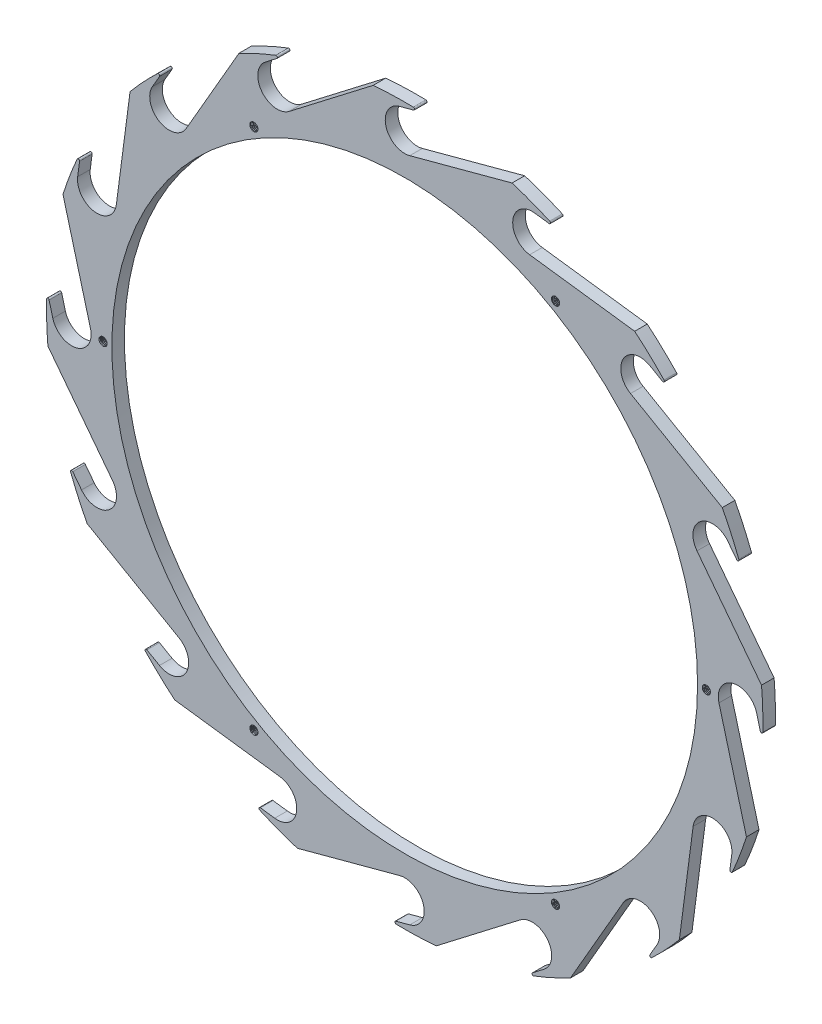
from build123d import *

# Parameters (mm, degrees)
SCHIZZO1_R                   = 233
ESTRUSIONE_ESTRUSIONE1_DEPTH = 10
RACCORDO2_R                  = 1
SCHIZZO2_R                   = 3.25
TAGLIO_ESTRUSIONE1_DEPTH     = 10
FILETTATURA1_PITCH           = 1
RIPETIZIONECIRCOLARE1_COUNT  = 6


with BuildPart() as part:
    # Schizzo1 → Estrusione-Estrusione1 (new body)
    with BuildSketch(Plane.XY):
        with BuildLine():
            Line((4.021991586, -279.969087604), (-13.509722748, -284.679622367))
            ThreePointArc((-13.509722748, -284.679622367), (5.828317807, -284.940398525), (25.139519914, -283.889070833))
            Line((25.139519914, -283.889070833), (91.966852047, -232.537592003))
            ThreePointArc((91.966852047, -232.537592003), (113.701593689, -235.383818586), (110.855367107, -257.118560228))
            Line((110.855367107, -257.118560228), (96.460818675, -268.1796235))
            ThreePointArc((96.460818675, -268.1796235), (114.426633258, -261.020201519), (131.865531943, -252.658824278))
            Line((131.865531943, -252.658824278), (173.954576137, -179.642531186))
            ThreePointArc((173.954576137, -179.642531186), (195.124062843, -173.954576137), (200.812017891, -195.124062843))
            Line((200.812017891, -195.124062843), (191.746074875, -210.851708009))
            ThreePointArc((191.746074875, -210.851708009), (205.604531075, -197.362044987), (218.516212097, -182.963562084))
            Line((218.516212097, -182.963562084), (229.459292913, -99.39852346))
            ThreePointArc((229.459292913, -99.39852346), (246.840662233, -86.042326374), (260.196859318, -103.423695694))
            Line((260.196859318, -103.423695694), (257.839729357, -121.423531349))
            ThreePointArc((257.839729357, -121.423531349), (265.481002846, -103.657306196), (271.899779815, -85.413756132))
            Line((271.899779815, -85.413756132), (250.030912396, -4.021991586))
            ThreePointArc((250.030912396, -4.021991586), (260.978008414, 14.969087604), (279.969087604, 4.021991586))
            Line((279.969087604, 4.021991586), (284.679622367, -13.509722748))
            ThreePointArc((284.679622367, -13.509722748), (284.940398525, 5.828317807), (283.889070833, 25.139519914))
            Line((283.889070833, 25.139519914), (232.537592003, 91.966852047))
            ThreePointArc((232.537592003, 91.966852047), (235.383818586, 113.701593689), (257.118560228, 110.855367107))
            Line((257.118560228, 110.855367107), (268.1796235, 96.460818675))
            ThreePointArc((268.1796235, 96.460818675), (261.020201519, 114.426633258), (252.658824278, 131.865531943))
            Line((252.658824278, 131.865531943), (179.642531186, 173.954576137))
            ThreePointArc((179.642531186, 173.954576137), (173.954576137, 195.124062843), (195.124062843, 200.812017891))
            Line((195.124062843, 200.812017891), (210.851708009, 191.746074875))
            ThreePointArc((210.851708009, 191.746074875), (197.362044987, 205.604531075), (182.963562084, 218.516212097))
            Line((182.963562084, 218.516212097), (99.39852346, 229.459292913))
            ThreePointArc((99.39852346, 229.459292913), (86.042326374, 246.840662233), (103.423695694, 260.196859318))
            Line((103.423695694, 260.196859318), (121.423531349, 257.839729357))
            ThreePointArc((121.423531349, 257.839729357), (103.657306196, 265.481002846), (85.413756132, 271.899779815))
            Line((85.413756132, 271.899779815), (4.021991586, 250.030912396))
            ThreePointArc((4.021991586, 250.030912396), (-14.969087604, 260.978008414), (-4.021991586, 279.969087604))
            Line((-4.021991586, 279.969087604), (13.509722748, 284.679622367))
            ThreePointArc((13.509722748, 284.679622367), (-5.828317807, 284.940398525), (-25.139519914, 283.889070833))
            Line((-25.139519914, 283.889070833), (-91.966852047, 232.537592003))
            ThreePointArc((-91.966852047, 232.537592003), (-113.701593689, 235.383818586), (-110.855367107, 257.118560228))
            Line((-110.855367107, 257.118560228), (-96.460818675, 268.1796235))
            ThreePointArc((-96.460818675, 268.1796235), (-114.426633258, 261.020201519), (-131.865531943, 252.658824278))
            Line((-131.865531943, 252.658824278), (-173.954576137, 179.642531186))
            ThreePointArc((-173.954576137, 179.642531186), (-195.124062843, 173.954576137), (-200.812017891, 195.124062843))
            Line((-200.812017891, 195.124062843), (-191.746074875, 210.851708009))
            ThreePointArc((-191.746074875, 210.851708009), (-205.604531075, 197.362044987), (-218.516212097, 182.963562084))
            Line((-218.516212097, 182.963562084), (-229.459292913, 99.39852346))
            ThreePointArc((-229.459292913, 99.39852346), (-246.840662233, 86.042326374), (-260.196859318, 103.423695694))
            Line((-260.196859318, 103.423695694), (-257.839729357, 121.423531349))
            ThreePointArc((-257.839729357, 121.423531349), (-265.481002846, 103.657306196), (-271.899779815, 85.413756132))
            Line((-271.899779815, 85.413756132), (-250.030912396, 4.021991586))
            ThreePointArc((-250.030912396, 4.021991586), (-260.978008414, -14.969087604), (-279.969087604, -4.021991586))
            Line((-279.969087604, -4.021991586), (-284.679622367, 13.509722748))
            ThreePointArc((-284.679622367, 13.509722748), (-284.940398525, -5.828317807), (-283.889070833, -25.139519914))
            Line((-283.889070833, -25.139519914), (-232.537592003, -91.966852047))
            ThreePointArc((-232.537592003, -91.966852047), (-235.383818586, -113.701593689), (-257.118560228, -110.855367107))
            Line((-257.118560228, -110.855367107), (-268.1796235, -96.460818675))
            ThreePointArc((-268.1796235, -96.460818675), (-261.020201519, -114.426633258), (-252.658824278, -131.865531943))
            Line((-252.658824278, -131.865531943), (-179.642531186, -173.954576137))
            ThreePointArc((-179.642531186, -173.954576137), (-173.954576137, -195.124062843), (-195.124062843, -200.812017891))
            Line((-195.124062843, -200.812017891), (-210.851708009, -191.746074875))
            ThreePointArc((-210.851708009, -191.746074875), (-197.362044987, -205.604531075), (-182.963562084, -218.516212097))
            Line((-182.963562084, -218.516212097), (-99.39852346, -229.459292913))
            ThreePointArc((-99.39852346, -229.459292913), (-86.042326374, -246.840662233), (-103.423695694, -260.196859318))
            Line((-103.423695694, -260.196859318), (-121.423531349, -257.839729357))
            ThreePointArc((-121.423531349, -257.839729357), (-103.657306196, -265.481002846), (-85.413756132, -271.899779815))
            Line((-85.413756132, -271.899779815), (-4.021991586, -250.030912396))
            ThreePointArc((-4.021991586, -250.030912396), (14.969087604, -260.978008414), (4.021991586, -279.969087604))
        make_face()
        Circle(SCHIZZO1_R, mode=Mode.SUBTRACT)
    extrude(amount=ESTRUSIONE_ESTRUSIONE1_DEPTH)

    # Raccordo2
    raccordo2_edges = [part.edges().sort_by_distance(p)[0] for p in [
        (-121.423531349, -257.839729357, 5),
        (-210.851708009, -191.746074875, 5),
        (-268.1796235, -96.460818675, 5),
        (-284.679622367, 13.509722748, 5),
        (-257.839729357, 121.423531349, 5),
        (-191.746074875, 210.851708009, 5),
        (-96.460818675, 268.1796235, 5),
        (13.509722748, 284.679622367, 5),
        (121.423531349, 257.839729357, 5),
        (210.851708009, 191.746074875, 5),
        (268.1796235, 96.460818675, 5),
        (284.679622367, -13.509722748, 5),
        (257.839729357, -121.423531349, 5),
        (191.746074875, -210.851708009, 5),
        (96.460818675, -268.1796235, 5),
        (-13.509722748, -284.679622367, 5),
    ]]
    fillet(raccordo2_edges, radius=RACCORDO2_R)

    # Schizzo2 → Taglio-Estrusione1 (cut)
    with BuildSketch(Plane.XY.offset(10)):
        with Locations((-240, 0)):
            Circle(SCHIZZO2_R)
    taglio_estrusione1 = extrude(amount=-TAGLIO_ESTRUSIONE1_DEPTH, mode=Mode.SUBTRACT)

    # Filettatura1: the profile of Profilo filettatura1 profile screwed along a right-hand helix of 10 turns, 8 arcs to a turn; built about Z, then put on its axis
    filettatura1_z = Axis((0, 0, 0), (0, 0, 1))
    filettatura1_corners = [(3.2497, 0, -0.000173205), (3.791265875, 0, 0.312499999), (3.791265875, 0, 0.437499999), (3.2497, 0, 0.750173202)]
    with BuildLine(mode=Mode.PRIVATE) as filettatura1_profile:
        Line(filettatura1_corners[0], filettatura1_corners[1])
        Line(filettatura1_corners[1], filettatura1_corners[2])
        Line(filettatura1_corners[2], filettatura1_corners[3])
        Line(filettatura1_corners[3], filettatura1_corners[0])
    filettatura1_cap = Face(filettatura1_profile.wire())
    filettatura1_turn_angles = [0, 22.5, 45, 67.5, 90, 112.5, 135, 157.5, 180, 202.5, 225, 247.5, 270, 292.5, 315, 337.5, 360]
    filettatura1_turn_weights = [1, 0.9238795325112867, 1, 0.9238795325112867, 1, 0.9238795325112867, 1, 0.9238795325112867, 1, 0.9238795325112867, 1, 0.9238795325112867, 1, 0.9238795325112867, 1, 0.9238795325112867, 1]
    filettatura1_turn_rails = [Edge.make_bspline([Vector(p[0], p[1], 0).rotate(filettatura1_z, filettatura1_turn_angles[k]) / filettatura1_turn_weights[k] + Vector(0, 0, p[2] + FILETTATURA1_PITCH * filettatura1_turn_angles[k] / 360) for k in range(17)], [0, 0, 0, 1, 1, 2, 2, 3, 3, 4, 4, 5, 5, 6, 6, 7, 7, 8, 8, 8], 2, filettatura1_turn_weights) for p in filettatura1_corners]
    filettatura1_turn_sides = [Face.make_surface_from_curves(filettatura1_turn_rails[p[0]], filettatura1_turn_rails[p[1]]) for p in [(0, 1), (1, 2), (2, 3), (3, 0)]]
    filettatura1 = Plane(origin=(-240, 0, 10), x_dir=(-1, 0, 0), z_dir=(0, 0, -1)) * Solid(Shell([*[p.moved(Location((0, 0, FILETTATURA1_PITCH * i))) for i in range(10) for p in filettatura1_turn_sides], filettatura1_cap, filettatura1_cap.rotate(filettatura1_z, 3600).moved(Location((0, 0, FILETTATURA1_PITCH * 3600 / 360)))]))
    add(filettatura1, mode=Mode.SUBTRACT)

    # RipetizioneCircolare1: Taglio-Estrusione1, Filettatura1 ×6 about axis
    ripetizionecircolare1_axis = Axis((0, 0, 10), (0, 0, 1))
    add([taglio_estrusione1.rotate(ripetizionecircolare1_axis, i * 360 / RIPETIZIONECIRCOLARE1_COUNT) for i in range(1, RIPETIZIONECIRCOLARE1_COUNT)], mode=Mode.SUBTRACT)
    add([filettatura1.rotate(ripetizionecircolare1_axis, i * 360 / RIPETIZIONECIRCOLARE1_COUNT) for i in range(1, RIPETIZIONECIRCOLARE1_COUNT)], mode=Mode.SUBTRACT)


solid = part.part
